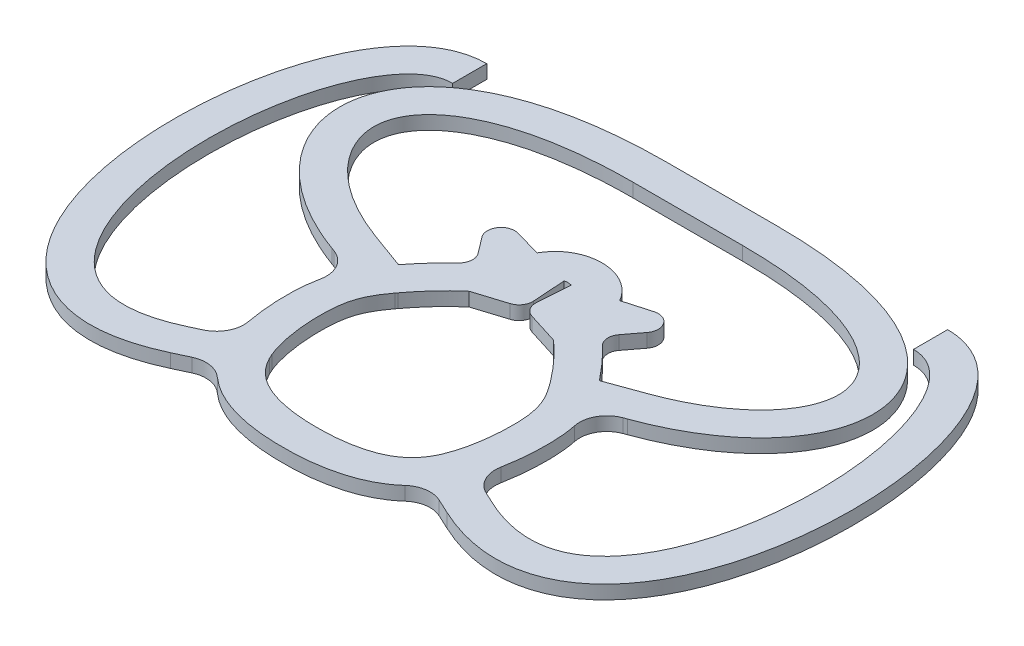
from build123d import *

# Parameters (mm, degrees)
BOSS_EXTRUDE1_DEPTH = 5
BOSS_EXTRUDE2_DEPTH = 5
BOSS_EXTRUDE3_DEPTH = 5
FILLET1_R           = 10
FILLET2_R           = 5
BOSS_EXTRUDE4_DEPTH = 5


# Read off the part's stored shape, not the designer's step: Boss-Extrude1
with BuildPart() as part:
    # Boss-Extrude1 outline → Boss-Extrude1 (new body)
    with BuildSketch(Plane(origin=(0, 0, 0), x_dir=(1, 0, 0), z_dir=(0, 1, 0))):
        with BuildLine():
            add(Edge.make_bspline(
                [(0.336543252, 64.995468724), (-0.339630857, 65.01365297), (-1.702995085, 64.980415334), (-4.708925437, 64.549322828), (-7.973475941, 63.376856775), (-11.023212138, 61.297500206), (-13.034924904, 59.360880173), (-14.400040319, 57.531164508), (-15.292441135, 56.00794863), (-16.05945075, 54.446041982), (-16.686471177, 52.770845219), (-17.348671951, 50.509550788), (-17.736677005, 48.73150217), (-18.040961959, 47.365077972), (-18.229584616, 46.581158766), (-18.374648505, 46.079609294), (-18.44042094, 45.905206763), (-18.519382177, 45.735901922), (-18.667920409, 45.502929291), (-19.032101566, 45.059969004), (-19.956495539, 44.138670965), (-21.656377727, 42.723537352), (-24.022163184, 40.773502671), (-26.721443548, 38.386607898), (-29.844466616, 35.284397101), (-33.355009656, 31.404421118), (-36.002819592, 28.190325521), (-37.92762765, 25.696054706), (-39.707006167, 23.284669641), (-41.828878362, 20.147287392), (-44.110930282, 15.925410534), (-45.8954627, 11.195747716), (-47.017196429, 6.151642912), (-47.54466528, 0.920358135), (-47.63634654, -4.729023135), (-47.302794317, -10.817640198), (-46.490262557, -17.138122194), (-45.096204862, -23.528594778), (-43.320327046, -28.778535221), (-41.273758963, -32.967454747), (-38.855930026, -36.851757462), (-35.260618796, -41.01153087), (-30.403934736, -44.773826455), (-25.445725907, -47.405517381), (-20.669066201, -49.160160775), (-16.290019662, -50.313406865), (-11.983255208, -51.115267257), (-7.819920866, -51.599328263), (-3.797453032, -51.838863549), (0.020266012, -51.89546973), (3.811632894, -51.829197054), (7.766736732, -51.587347484), (11.82850454, -51.118458997), (16.015407887, -50.35832152), (20.237296136, -49.294715251), (24.926373113, -47.670944566), (29.87879797, -45.177355897), (34.793942361, -41.531410469), (38.468084936, -37.423912498), (40.943316087, -33.574894289), (43.070956553, -29.360089244), (44.91226104, -24.040239993), (46.365611689, -17.554437602), (47.23097738, -11.113662864), (47.609512137, -4.902527807), (47.551948602, 0.857673745), (47.04156145, 6.172176242), (45.915153922, 11.279867611), (44.101039994, 16.048624184), (41.788609177, 20.26193152), (39.66399469, 23.357912285), (37.899233916, 25.726772553), (35.988364925, 28.187577593), (33.357507021, 31.372971858), (29.865652315, 35.237382838), (26.754908009, 38.342391962), (24.069205532, 40.738626335), (21.701745305, 42.713303167), (19.968782422, 44.170730537), (19.002383349, 45.136130396), (18.618936642, 45.601833714), (18.478269409, 45.824719165), (18.429010578, 45.937143499), (18.392781135, 46.027315039), (18.267436073, 46.464621059), (18.097099849, 47.192705758), (17.815830567, 48.500896871), (17.449383968, 50.250771114), (16.800426349, 52.511103211), (16.066970546, 54.510655696), (14.798629778, 56.948180373), (13.147652859, 59.154924552), (11.181072397, 61.06566174), (8.279898071, 63.098837807), (5.23408044, 64.311121847), (2.354049568, 64.871309859), (1.012717361, 64.977284479), (0.336543252, 64.995468724)],
                knots=[0, 0, 0, 0, 0.00390625, 0.0078125, 0.015625, 0.01953125, 0.0234375, 0.02734375, 0.029296875, 0.03125, 0.03515625, 0.0390625, 0.046875, 0.05078125, 0.0546875, 0.05859375, 0.0625, 0.0703125, 0.078125, 0.0859375, 0.09375, 0.109375, 0.1171875, 0.125, 0.140625, 0.15625, 0.171875, 0.1796875, 0.1875, 0.203125, 0.21875, 0.234375, 0.25, 0.265625, 0.28125, 0.296875, 0.3125, 0.328125, 0.34375, 0.3515625, 0.359375, 0.375, 0.390625, 0.40625, 0.421875, 0.4375, 0.453125, 0.46875, 0.484375, 0.5, 0.515625, 0.53125, 0.546875, 0.5625, 0.578125, 0.59375, 0.609375, 0.625, 0.640625, 0.6484375, 0.65625, 0.671875, 0.6875, 0.703125, 0.71875, 0.734375, 0.75, 0.765625, 0.78125, 0.796875, 0.8125, 0.8203125, 0.828125, 0.84375, 0.859375, 0.875, 0.8828125, 0.890625, 0.90625, 0.9140625, 0.921875, 0.9296875, 0.9375, 0.94140625, 0.9453125, 0.94921875, 0.953125, 0.9609375, 0.96484375, 0.96875, 0.97265625, 0.9765625, 0.98046875, 0.984375, 0.9921875, 0.99609375, 1, 1, 1, 1], degree=3))
        make_face()
        with BuildLine():
            add(Edge.make_bspline(
                [(0, 52.5), (-1.721071682, 52.546354008), (-5.023998095, 51.233565024), (-6.323060915, 37.961902054), (-16.72278471, 31.741990575), (-31.117683568, 14.955497586), (-36.553974343, 3.663736091), (-33.187275504, -30.146909076), (-15.980150699, -38.594852737), (0.139720776, -39.754618009), (15.891625076, -38.533398343), (33.010071371, -30.567020646), (36.583768429, 3.98657687), (31.092499601, 14.934506796), (16.757167605, 31.680356213), (6.162520537, 38.211789736), (5.189811126, 51.006110328), (1.662583855, 52.455221257), (0, 52.5)],
                knots=[0, 0, 0, 0, 0.03031502, 0.060187434, 0.120481774, 0.182983676, 0.266134617, 0.349103446, 0.429415993, 0.5, 0.571597832, 0.652658902, 0.733865383, 0.817016324, 0.879518226, 0.939812566, 0.970715187, 1, 1, 1, 1], degree=3))
        make_face(mode=Mode.SUBTRACT)
    extrude(amount=BOSS_EXTRUDE1_DEPTH)

    # Sketch11 → Boss-Extrude2 (add)
    with BuildSketch(Plane(origin=(0, 0, 0), x_dir=(1, 0, 0), z_dir=(0, 1, 0))):
        Polygon((50.64133054, -42.479880212), (55.924058812, -31.151032875), (33.266364136, -20.585576331), (27.983635864, -31.914423669), align=None)
        Polygon((24.532422054, 22.729778943), (49.792189624, 31.923582463), (54.067441415, 20.177424703), (32.342577946, 12.270221057), align=None)
        Polygon((-49.792189624, 31.923582463), (-54.067441415, 20.177424703), (-32.342577946, 12.270221057), (-24.532422054, 22.729778943), align=None)
        Polygon((-55.924058812, -31.151032875), (-33.266364136, -20.585576331), (-27.983635864, -31.914423669), (-50.64133054, -42.479880212), align=None)
    extrude(amount=BOSS_EXTRUDE2_DEPTH)

    # Sketch12 → Boss-Extrude3 (add)
    with BuildSketch(Plane(origin=(0, 0, 0), x_dir=(1, 0, 0), z_dir=(0, 1, 0))):
        Polygon((39.315430327, 63.158881586), (1.301983206, 52.320162197), (0.25, 36.460954474), (15.407904263, 31.679837803), align=None)
        Polygon((-0.25, 36.460954474), (-15.407904263, 31.679837803), (-39.315430327, 63.158881586), (-1.301983206, 52.320162197), align=None)
    extrude(amount=BOSS_EXTRUDE3_DEPTH)

    # Fillet1
    fillet1_edges = [part.edges().sort_by_distance(p)[0] for p in [
        (43.792413644, 2.5, -16.437620438),
        (44.274589894, 2.5, 25.718796305),
        (38.688255139, 2.5, 36.906069615),
        (-38.656174107, 2.5, 36.891109984),
        (-44.30626248, 2.5, 25.733565474),
        (-43.756602708, 2.5, -16.424586323),
    ]]
    fillet(fillet1_edges, radius=FILLET1_R)

    # Fillet2
    fillet2_edges = [part.edges().sort_by_distance(p)[0] for p in [
        (-39.315430327, 2.5, -63.158881586),
        (39.315430327, 2.5, -63.158881586),
        (22.978279187, 2.5, -41.647751799),
        (-22.971342839, 2.5, -41.638618709),
        (0.25, 2.5, -36.460954474),
        (-0.25, 2.5, -36.460954474),
    ]]
    fillet(fillet2_edges, radius=FILLET2_R)

    # Sketch13 → Boss-Extrude4 (add)
    with BuildSketch(Plane(origin=(0, 0, 0), x_dir=(1, 0, 0), z_dir=(0, 1, 0))):
        with BuildLine():
            Line((-54.067441415, 20.177424703), (-49.792189624, 31.923582463))
            add(Edge.make_bspline(
                [(-49.792189624, 31.923582463), (-50.618348822, 32.22427982), (-52.277066371, 32.853600788), (-55.443678375, 34.15689721), (-59.198131376, 35.893110197), (-63.346361352, 38.118936517), (-68.403082897, 41.252523938), (-73.81786257, 45.426513306), (-78.83703494, 50.668341112), (-82.373201037, 55.952826829), (-84.469151892, 61.096271144), (-85.225859251, 65.973412158), (-84.75103809, 70.594715256), (-83.022310458, 75.095719158), (-79.831561302, 79.562431759), (-74.920295842, 83.906030251), (-68.105860774, 87.921497836), (-60.757967102, 90.804971408), (-53.851393776, 92.730208985), (-48.152810125, 93.959920197), (-41.931218291, 94.952879882), (-36.307618776, 95.56531615), (-31.543079291, 95.916069271), (-27.837280923, 96.107073992), (-24.635249355, 96.204165848), (-22.012102865, 96.243396237), (-20.667998073, 96.25), (-20, 96.25)],
                knots=[0, 0, 0, 0, 0.015625, 0.03125, 0.0625, 0.09375, 0.125, 0.1875, 0.25, 0.3125, 0.375, 0.4375, 0.5, 0.5625, 0.625, 0.6875, 0.75, 0.8125, 0.84375, 0.875, 0.90625, 0.9375, 0.953125, 0.96875, 0.984375, 0.9921875, 1, 1, 1, 1], degree=3))
            Line((-20, 96.25), (20, 96.25))
            add(Edge.make_bspline(
                [(20, 96.25), (20.667998073, 96.25), (22.012102865, 96.243396237), (24.635249355, 96.204165848), (27.837280923, 96.107073992), (31.543079291, 95.916069271), (36.307618776, 95.56531615), (41.931218291, 94.952879882), (48.152810125, 93.959920197), (53.851393776, 92.730208985), (60.757967102, 90.804971408), (68.105860774, 87.921497836), (74.920295842, 83.906030251), (79.831561302, 79.562431759), (83.022310458, 75.095719158), (84.75103809, 70.594715256), (85.225859251, 65.973412158), (84.469151892, 61.096271144), (82.373201037, 55.952826829), (78.83703494, 50.668341112), (73.81786257, 45.426513306), (68.403082897, 41.252523938), (63.346361352, 38.118936517), (59.198131376, 35.893110197), (55.443678375, 34.15689721), (52.277066371, 32.853600788), (50.618348822, 32.22427982), (49.792189624, 31.923582463)],
                knots=[0, 0, 0, 0, 0.0078125, 0.015625, 0.03125, 0.046875, 0.0625, 0.09375, 0.125, 0.15625, 0.1875, 0.25, 0.3125, 0.375, 0.4375, 0.5, 0.5625, 0.625, 0.6875, 0.75, 0.8125, 0.875, 0.90625, 0.9375, 0.96875, 0.984375, 1, 1, 1, 1], degree=3))
            Line((49.792189624, 31.923582463), (54.067441415, 20.177424703))
            add(Edge.make_bspline(
                [(20, 108.75), (21.40808254, 108.75), (24.25447038, 108.721984249), (28.341479164, 108.597708067), (32.320317569, 108.392941617), (37.456420814, 108.014893578), (43.5740968, 107.349641109), (50.435438261, 106.255913397), (56.825699388, 104.878714995), (64.727435437, 102.67876174), (73.462762647, 99.271384761), (82.158229801, 94.18876211), (89.060459347, 88.151110441), (94.080339288, 81.219322577), (97.052920278, 73.570485444), (97.863630517, 65.556516248), (96.58363989, 57.578864589), (93.414195069, 49.913900885), (88.549859468, 42.702290091), (82.126792041, 36.026178315), (75.550092567, 30.972139913), (69.585406553, 27.277965808), (64.768294146, 24.694680119), (60.468005169, 22.706887805), (56.870438588, 21.226466507), (55.000540319, 20.51704493), (54.067441415, 20.177424703)],
                knots=[0, 0, 0, 0, 0.015625, 0.03125, 0.046875, 0.0625, 0.09375, 0.125, 0.15625, 0.1875, 0.25, 0.3125, 0.375, 0.4375, 0.5, 0.5625, 0.625, 0.6875, 0.75, 0.8125, 0.875, 0.90625, 0.9375, 0.96875, 0.984375, 1, 1, 1, 1], degree=3))
            Line((20, 108.75), (-20, 108.75))
            add(Edge.make_bspline(
                [(-54.067441415, 20.177424703), (-55.000540319, 20.51704493), (-56.870438588, 21.226466507), (-60.468005169, 22.706887805), (-64.768294146, 24.694680119), (-69.585406553, 27.277965808), (-75.550092567, 30.972139913), (-82.126792041, 36.026178315), (-88.549859468, 42.702290091), (-93.414195069, 49.913900885), (-96.58363989, 57.578864589), (-97.863630517, 65.556516248), (-97.052920278, 73.570485444), (-94.080339288, 81.219322577), (-89.060459347, 88.151110441), (-82.158229801, 94.18876211), (-73.462762647, 99.271384761), (-64.727435437, 102.67876174), (-56.825699388, 104.878714995), (-50.435438261, 106.255913397), (-43.5740968, 107.349641109), (-37.456420814, 108.014893578), (-32.320317569, 108.392941617), (-28.341479164, 108.597708067), (-24.25447038, 108.721984249), (-21.40808254, 108.75), (-20, 108.75)],
                knots=[0, 0, 0, 0, 0.015625, 0.03125, 0.0625, 0.09375, 0.125, 0.1875, 0.25, 0.3125, 0.375, 0.4375, 0.5, 0.5625, 0.625, 0.6875, 0.75, 0.8125, 0.84375, 0.875, 0.90625, 0.9375, 0.953125, 0.96875, 0.984375, 1, 1, 1, 1], degree=3))
        make_face()
        with BuildLine():
            Line((-55.924058812, -31.151032875), (-50.64133054, -42.479880212))
            add(Edge.make_bspline(
                [(-50.64133054, -42.479880212), (-51.311094635, -42.792196339), (-52.670614174, -43.402987507), (-55.334380119, -44.506641169), (-58.623820433, -45.695498453), (-62.489085254, -46.810998346), (-67.540636058, -47.889686406), (-73.65768071, -48.474143082), (-80.640129436, -47.968321677), (-87.17933436, -46.298823543), (-95.186446893, -42.646316805), (-103.684191817, -35.75457758), (-111.51518103, -24.841171133), (-119.236793499, -7.721849438), (-124.385960379, 17.156788493), (-124.296439292, 43.289558882), (-121.254857238, 62.891973043), (-117.492254567, 76.44266387), (-112.196774482, 88.359258977), (-106.348856521, 96.539636369), (-100.600120354, 101.685476716), (-95.705367202, 104.686803611), (-91.153311216, 106.300709309), (-87.310149257, 106.962080586), (-85.321453787, 107.073802249), (-84.333157022, 107.073802249)],
                knots=[0, 0, 0, 0, 0.0078125, 0.015625, 0.03125, 0.046875, 0.0625, 0.09375, 0.125, 0.15625, 0.1875, 0.25, 0.3125, 0.375, 0.5, 0.625, 0.6875, 0.75, 0.8125, 0.875, 0.90625, 0.9375, 0.96875, 0.984375, 1, 1, 1, 1], degree=3))
            Line((-84.333157022, 107.073802249), (-84.333157022, 94.573802249))
            add(Edge.make_bspline(
                [(-55.924058812, -31.151032875), (-56.485595983, -31.412881958), (-57.630466153, -31.927202839), (-59.833407762, -32.839550812), (-62.503907458, -33.803513109), (-65.549780369, -34.680780971), (-69.409796257, -35.502658696), (-73.859796167, -35.916442986), (-78.655605676, -35.559040402), (-83.003214566, -34.445678555), (-88.338669222, -32.017307791), (-94.347540471, -27.217831797), (-100.541911761, -18.691633962), (-105.481099456, -7.815742916), (-109.029840697, 4.811012303), (-111.138913491, 18.560388819), (-111.811220951, 32.807423895), (-111.078592292, 46.932565105), (-108.995513597, 60.314532264), (-105.646809908, 72.319113162), (-101.175415546, 82.294997018), (-96.747569105, 88.360977262), (-93.037789761, 91.646738153), (-90.234624679, 93.344607686), (-87.865807048, 94.17480898), (-85.901554925, 94.514707711), (-84.851068607, 94.573802249), (-84.333157022, 94.573802249)],
                knots=[0, 0, 0, 0, 0.0078125, 0.015625, 0.03125, 0.046875, 0.0625, 0.09375, 0.125, 0.15625, 0.1875, 0.25, 0.3125, 0.375, 0.4375, 0.5, 0.5625, 0.625, 0.6875, 0.75, 0.8125, 0.875, 0.90625, 0.9375, 0.96875, 0.984375, 1, 1, 1, 1], degree=3))
        make_face()
        with BuildLine():
            Line((50.64133054, -42.479880212), (55.924058812, -31.151032875))
            add(Edge.make_bspline(
                [(84.333157022, 94.573802249), (84.851068607, 94.573802249), (85.901554925, 94.514707711), (87.865807048, 94.17480898), (90.234624679, 93.344607686), (93.037789761, 91.646738153), (96.747569105, 88.360977262), (101.175415546, 82.294997018), (105.646809908, 72.319113162), (108.995513597, 60.314532264), (111.078592292, 46.932565105), (111.811220951, 32.807423895), (111.138913491, 18.560388819), (109.029840697, 4.811012303), (105.481099456, -7.815742916), (100.541911761, -18.691633962), (94.347540471, -27.217831797), (88.338669222, -32.017307791), (83.003214566, -34.445678555), (78.655605676, -35.559040402), (73.859796167, -35.916442986), (69.409796257, -35.502658696), (65.549780369, -34.680780971), (62.503907458, -33.803513109), (59.833407762, -32.839550812), (57.630466153, -31.927202839), (56.485595983, -31.412881958), (55.924058812, -31.151032875)],
                knots=[0, 0, 0, 0, 0.015625, 0.03125, 0.0625, 0.09375, 0.125, 0.1875, 0.25, 0.3125, 0.375, 0.4375, 0.5, 0.5625, 0.625, 0.6875, 0.75, 0.8125, 0.84375, 0.875, 0.90625, 0.9375, 0.953125, 0.96875, 0.984375, 0.9921875, 1, 1, 1, 1], degree=3))
            Line((84.333157022, 94.573802249), (84.333157022, 107.073802249))
            add(Edge.make_bspline(
                [(84.333157022, 107.073802249), (85.321453787, 107.073802249), (87.310149257, 106.962080586), (91.153311216, 106.300709309), (95.705367202, 104.686803611), (100.600120354, 101.685476716), (106.348856521, 96.539636369), (112.196774482, 88.359258977), (117.492254567, 76.44266387), (121.254857238, 62.891973043), (124.296439292, 43.289558882), (124.385960379, 17.156788493), (119.236793499, -7.721849438), (111.51518103, -24.841171133), (103.684191817, -35.75457758), (95.186446893, -42.646316805), (87.17933436, -46.298823543), (80.640129436, -47.968321677), (73.65768071, -48.474143082), (67.540636058, -47.889686406), (62.489085254, -46.810998346), (58.623820433, -45.695498453), (55.334380119, -44.506641169), (52.670614174, -43.402987507), (51.311094635, -42.792196339), (50.64133054, -42.479880212)],
                knots=[0, 0, 0, 0, 0.015625, 0.03125, 0.0625, 0.09375, 0.125, 0.1875, 0.25, 0.3125, 0.375, 0.5, 0.625, 0.6875, 0.75, 0.8125, 0.84375, 0.875, 0.90625, 0.9375, 0.953125, 0.96875, 0.984375, 0.9921875, 1, 1, 1, 1], degree=3))
        make_face()
    extrude(amount=BOSS_EXTRUDE4_DEPTH)


solid = part.part
